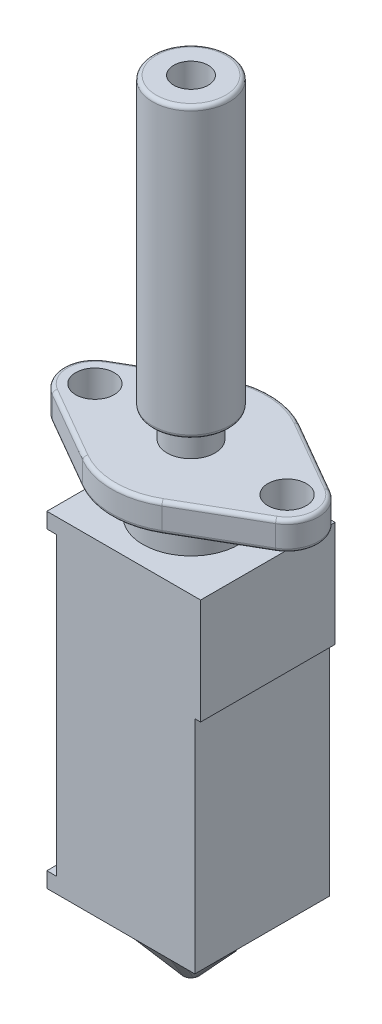
from build123d import *
from OCP.BRepFilletAPI import BRepFilletAPI_MakeChamfer

# Parameters (mm, degrees)
SKETCH1_W           = 8
SKETCH1_H           = 7
BOSS_EXTRUDE1_DEPTH = 17
BOSS_EXTRUDE2_DEPTH = 4
CHAMFER1_SIZE       = 2.5
CHAMFER1_SIZE_2     = 2
SKETCH3_R           = 0.4
CUT_EXTRUDE1_DEPTH  = 18.811513131
FILLET2_R           = 0.5
SKETCH4_W           = 0.5
SKETCH4_H           = 15.4
CUT_EXTRUDE2_DEPTH  = 19.814887722
SKETCH5_W           = 0.3
SKETCH5_H           = 11.5
CUT_EXTRUDE3_DEPTH  = 19.814887722
SKETCH6_R           = 0.9
CUT_EXTRUDE4_DEPTH  = 18
CHAMFER2_SIZE       = 0.5
BOSS_EXTRUDE3_START = 2
SKETCH7_R           = 2.5
SKETCH7_R_2         = 0.9
BOSS_EXTRUDE3_DEPTH = 2
BOSS_EXTRUDE4_START = 1.5
SKETCH8_R           = 0.9
SKETCH8_R_2         = 1
BOSS_EXTRUDE4_DEPTH = 1.5
BOSS_EXTRUDE5_START = 1.4
SKETCH9_R           = 1.25
SKETCH9_R_2         = 0.9
BOSS_EXTRUDE5_DEPTH = 1.4
BOSS_EXTRUDE6_START = 15
SKETCH10_R          = 2
SKETCH10_R_2        = 0.9
BOSS_EXTRUDE6_DEPTH = 15
FILLET3_R           = 0.2


# Some blends are built 0.0001 mm under size
with BuildPart() as part:
    # Sketch1 → Boss-Extrude1 (new body)
    with BuildSketch(Plane(origin=(0, 0, 0), x_dir=(1, 0, 0), z_dir=(0, 1, 0))):
        Rectangle(SKETCH1_W, SKETCH1_H)
    extrude(amount=BOSS_EXTRUDE1_DEPTH)

    # Sketch2 → Boss-Extrude2 (add)
    with BuildSketch(Plane(origin=(0, 0, 0), x_dir=(-1, 0, 0), z_dir=(0, -1, 0))):
        Polygon((-2.309401077, 0), (-1.154700538, -2), (1.154700538, -2), (2.309401077, 0), (1.154700538, 2), (-1.154700538, 2), align=None)
    extrude(amount=BOSS_EXTRUDE2_DEPTH)

    # Chamfer1
    chamfer1_edges_1 = [part.edges().sort_by_distance(p)[0] for p in [
        (1.732050808, -4, -1),
    ]]
    chamfer1_side_1 = [part.faces().sort_by_distance(p)[0] for p in [
        (1.732050808, -3.96, -1),
    ]]
    chamfer1_edges_2 = [part.edges().sort_by_distance(p)[0] for p in [
        (1.732050808, -4, 1),
    ]]
    chamfer1_side_2 = [part.faces().sort_by_distance(p)[0] for p in [
        (1.732050808, -3.96, 1),
    ]]
    chamfer1_edges_3 = [part.edges().sort_by_distance(p)[0] for p in [
        (0, -4, 2),
    ]]
    chamfer1_side_3 = [part.faces().sort_by_distance(p)[0] for p in [
        (0, -3.96, 2),
    ]]
    chamfer1_edges_4 = [part.edges().sort_by_distance(p)[0] for p in [
        (-1.732050808, -4, 1),
    ]]
    chamfer1_side_4 = [part.faces().sort_by_distance(p)[0] for p in [
        (-1.732050808, -3.96, 1),
    ]]
    chamfer1_edges_5 = [part.edges().sort_by_distance(p)[0] for p in [
        (-1.732050808, -4, -1),
    ]]
    chamfer1_side_5 = [part.faces().sort_by_distance(p)[0] for p in [
        (-1.732050808, -3.96, -1),
    ]]
    chamfer1_edges_6 = [part.edges().sort_by_distance(p)[0] for p in [
        (0, -4, -2),
    ]]
    chamfer1_side_6 = [part.faces().sort_by_distance(p)[0] for p in [
        (0, -3.96, -2),
    ]]
    chamfer1 = BRepFilletAPI_MakeChamfer(part.part.solid().wrapped)
    for e in chamfer1_edges_1:
        chamfer1.Add(CHAMFER1_SIZE - 0.0001, CHAMFER1_SIZE_2 - 0.0001, e.wrapped, chamfer1_side_1[0].wrapped)
    for e in chamfer1_edges_2:
        chamfer1.Add(CHAMFER1_SIZE - 0.0001, CHAMFER1_SIZE_2 - 0.0001, e.wrapped, chamfer1_side_2[0].wrapped)
    for e in chamfer1_edges_3:
        chamfer1.Add(CHAMFER1_SIZE - 0.0001, CHAMFER1_SIZE_2 - 0.0001, e.wrapped, chamfer1_side_3[0].wrapped)
    for e in chamfer1_edges_4:
        chamfer1.Add(CHAMFER1_SIZE - 0.0001, CHAMFER1_SIZE_2 - 0.0001, e.wrapped, chamfer1_side_4[0].wrapped)
    for e in chamfer1_edges_5:
        chamfer1.Add(CHAMFER1_SIZE - 0.0001, CHAMFER1_SIZE_2 - 0.0001, e.wrapped, chamfer1_side_5[0].wrapped)
    for e in chamfer1_edges_6:
        chamfer1.Add(CHAMFER1_SIZE - 0.0001, CHAMFER1_SIZE_2 - 0.0001, e.wrapped, chamfer1_side_6[0].wrapped)
    add(Compound.cast(chamfer1.Shape()), mode=Mode.REPLACE)  # a hair under: the kernel refuses the full size

    # Sketch3 → Cut-Extrude1 (cut, through all)
    with BuildSketch(Plane(origin=(0, 0, 0), x_dir=(-1, 0, 0), z_dir=(0, -1, 0))):
        with Locations(Location((0, 0, 0), (0, 0, 300))):
            Circle(SKETCH3_R)
    extrude(amount=CUT_EXTRUDE1_DEPTH, mode=Mode.SUBTRACT)

    # Fillet2
    # the kernel refuses this fillet: 0.5 mm, written as the material it takes off along each edge
    with BuildSketch(Plane(origin=(1.334556511, -1.110696502, -2.311519683), x_dir=(0.65389042348858, 0.264929316245572, 0.7086887691106577), z_dir=(-0.3392737411625274, -0.7345565425685966, 0.5876393573674692)), Plane(origin=(-1.334556511, -1.110696502, -2.311519683), x_dir=(0.940687689170844, 0.2649293162455729, -0.2119413334771459), z_dir=(0.33927374116252723, -0.7345565425685966, 0.5876393573674691)), Plane(origin=(2.669113022, -1.110696502, 0), x_dir=(-0.2867972656822634, 0.26492931624557164, 0.9206301025878043), z_dir=(-0.6785474823250541, -0.7345565425685965, 0)), Plane(origin=(-2.669113022, -1.110696502, 0), x_dir=(0.2867972656822621, 0.2649293162455703, -0.9206301025878052), z_dir=(0.6785474823250541, -0.7345565425685966, 0))) as fillet2_piece_1:
        with BuildLine():
            CenterArc((FILLET2_R * 0.424096417587, FILLET2_R), FILLET2_R, 224.036746285, 45.963253715)
            Line((-FILLET2_R * 0.294797720102, FILLET2_R * 0.304880428418), (0, 0))
            Line((0, 0), (FILLET2_R * 0.424096417587, 0))
        make_face()
    extrude(amount=3.874194565, mode=Mode.SUBTRACT)
    with BuildSketch(Plane(origin=(1.334556511, -1.110696502, 2.311519683), x_dir=(0.6538904234885794, 0.26492931624557287, -0.708688769110658), z_dir=(-0.33927374116252706, -0.7345565425685967, -0.5876393573674692)), Plane(origin=(-1.334556511, -1.110696502, 2.311519683), x_dir=(0.9406876891708441, 0.2649293162455719, 0.2119413334771472), z_dir=(0.33927374116252734, -0.7345565425685966, -0.5876393573674692))) as fillet2_piece_2:
        with BuildLine():
            CenterArc((FILLET2_R * 0.424096417587, -FILLET2_R), FILLET2_R, 90, 45.963253715)
            Line((-FILLET2_R * 0.294797720102, -FILLET2_R * 0.304880428418), (0, 0))
            Line((0, 0), (FILLET2_R * 0.424096417587, 0))
        make_face()
    extrude(amount=3.874194565, mode=Mode.SUBTRACT)

    # Sketch4 → Cut-Extrude2 (cut, through all)
    with BuildSketch(Plane.XY.offset(3.5)):
        with Locations((-3.75, 8.5)):
            Rectangle(SKETCH4_W, SKETCH4_H)
    extrude(amount=-CUT_EXTRUDE2_DEPTH, mode=Mode.SUBTRACT)

    # Sketch5 → Cut-Extrude3 (cut, through all)
    with BuildSketch(Plane.XY.offset(3.5)):
        with Locations((3.85, 5.75)):
            Rectangle(SKETCH5_W, SKETCH5_H)
    extrude(amount=-CUT_EXTRUDE3_DEPTH, mode=Mode.SUBTRACT)

    # Sketch6 → Cut-Extrude4 (cut)
    with BuildSketch(Plane(origin=(0, 17, 0), x_dir=(1, 0, 0), z_dir=(0, 1, 0))):
        with Locations(Location((0, 0, 0), (0, 0, 270))):
            Circle(SKETCH6_R)
    extrude(amount=-CUT_EXTRUDE4_DEPTH, mode=Mode.SUBTRACT)

    # Chamfer2
    chamfer2_edges = [part.edges().sort_by_distance(p)[0] for p in [
        (0, -1, -0.9),
    ]]
    chamfer(chamfer2_edges, length=CHAMFER2_SIZE - 0.0001)  # a hair under: the kernel refuses the full size

    # Sketch7 → Boss-Extrude3 (add)
    with BuildSketch(Plane(origin=(0, 17, 0), x_dir=(1, 0, 0), z_dir=(0, 1, 0)).offset(BOSS_EXTRUDE3_START)):
        with Locations(Location((0, 0, 0), (0, 0, 270))):
            Circle(SKETCH7_R)
        with Locations(Location((0, 0, 0), (0, 0, 270))):
            Circle(SKETCH7_R_2, mode=Mode.SUBTRACT)
    extrude(amount=-BOSS_EXTRUDE3_DEPTH)

    # Sketch8 → Boss-Extrude4 (add)
    with BuildSketch(Plane(origin=(0, 19, 0), x_dir=(1, 0, 0), z_dir=(0, 1, 0)).offset(BOSS_EXTRUDE4_START)):
        with BuildLine():
            Line((2.0625, 3.572354791), (5.8125, 1.407291281))
            ThreePointArc((5.8125, 1.407291281), (6.625, 0), (5.8125, -1.407291281))
            Line((5.8125, -1.407291281), (2.0625, -3.572354791))
            ThreePointArc((2.0625, -3.572354791), (0, -4.125), (-2.0625, -3.572354791))
            Line((-2.0625, -3.572354791), (-5.8125, -1.407291281))
            ThreePointArc((-5.8125, -1.407291281), (-6.625, 0), (-5.8125, 1.407291281))
            Line((-5.8125, 1.407291281), (-2.0625, 3.572354791))
            ThreePointArc((-2.0625, 3.572354791), (0, 4.125), (2.0625, 3.572354791))
        make_face()
        with Locations(Location((0, 0, 0), (0, 0, 270))):
            Circle(SKETCH8_R, mode=Mode.SUBTRACT)
        with Locations(Location((5, 0, 0), (0, 0, 270))):
            Circle(SKETCH8_R_2, mode=Mode.SUBTRACT)
        with Locations(Location((-5, 0, 0), (0, 0, 270))):
            Circle(SKETCH8_R_2, mode=Mode.SUBTRACT)
    extrude(amount=-BOSS_EXTRUDE4_DEPTH)

    # Sketch9 → Boss-Extrude5 (add)
    with BuildSketch(Plane(origin=(0, 20.5, 0), x_dir=(1, 0, 0), z_dir=(0, 1, 0)).offset(BOSS_EXTRUDE5_START)):
        with Locations(Location((0, 0, 0), (0, 0, 270))):
            Circle(SKETCH9_R)
        with Locations(Location((0, 0, 0), (0, 0, 270))):
            Circle(SKETCH9_R_2, mode=Mode.SUBTRACT)
    extrude(amount=-BOSS_EXTRUDE5_DEPTH)

    # Sketch10 → Boss-Extrude6 (add)
    with BuildSketch(Plane(origin=(0, 21.9, 0), x_dir=(1, 0, 0), z_dir=(0, 1, 0)).offset(BOSS_EXTRUDE6_START)):
        with Locations(Location((0, 0, 0), (0, 0, 270))):
            Circle(SKETCH10_R)
        with Locations(Location((0, 0, 0), (0, 0, 270))):
            Circle(SKETCH10_R_2, mode=Mode.SUBTRACT)
    extrude(amount=-BOSS_EXTRUDE6_DEPTH)

    # Fillet3
    fillet3_edges = [part.edges().sort_by_distance(p)[0] for p in [
        (6.625, 20.5, 0),
        (3.9375, 20.5, -2.489823036),
        (0, 20.5, -4.125),
        (-3.9375, 20.5, -2.489823036),
        (-6.625, 20.5, 0),
        (-3.9375, 20.5, 2.489823036),
        (0, 20.5, 4.125),
        (3.9375, 20.5, 2.489823036),
        (6.625, 19, 0),
        (3.9375, 19, -2.489823036),
        (0, 19, -4.125),
        (-3.9375, 19, -2.489823036),
        (-6.625, 19, 0),
        (-3.9375, 19, 2.489823036),
        (0, 19, 4.125),
        (3.9375, 19, 2.489823036),
        (0, 36.9, -2),
        (0, 21.9, -2),
    ]]
    fillet(fillet3_edges, radius=FILLET3_R)


solid = part.part
